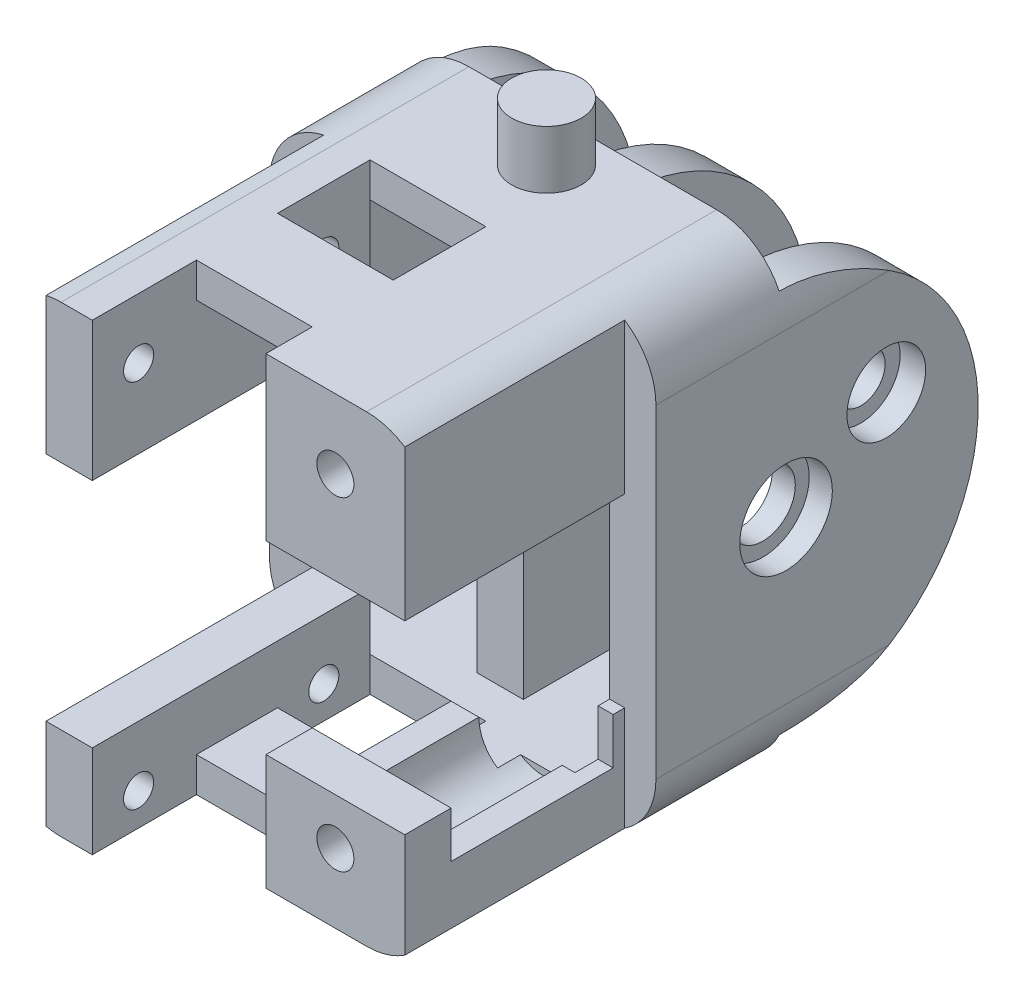
from build123d import *

# Parameters (mm, degrees)
BOSS_EXTRUDE1_DEPTH      = 18
BOSS_EXTRUDE1_DEPTH_BACK = 12
SKETCH9_R                = 1.5
BOSS_EXTRUDE4_DEPTH      = 2.5
BOSS_EXTRUDE5_START      = 2.5
SKETCH10_R               = 1.5
BOSS_EXTRUDE5_DEPTH      = 2.5
EXTRUDE7_DEPTH           = 24.45149249
EXTRUDE7_DEPTH_BACK      = 24.45149249
SKETCH21_R               = 1.4
EXTRUDE8_DEPTH           = 24.45149249
EXTRUDE8_DEPTH_BACK      = 24.45149249
EXTRUDE9_START           = 7.35
SKETCH25_R               = 2
EXTRUDE9_DEPTH           = 10
EXTRUDE10_DEPTH          = 10
EXTRUDE12_START          = 8.5
SKETCH29_R               = 3.5
EXTRUDE12_DEPTH          = 1.5
EXTRUDE13_DEPTH          = 24.451492602
EXTRUDE13_DEPTH_BACK     = 24.451492602
EXTRUDE14_DEPTH          = 1
EXTRUDE14_DEPTH_BACK     = 1
EXTRUDE15_DEPTH          = 10
EXTRUDE15_DEPTH_BACK     = 2
SKETCH_R                 = 1.05
EXTRUDE17_START          = 7.25
SKETCH32_R               = 1.7
EXTRUDE17_DEPTH          = 17.201492602
EXTRUDE22_DEPTH          = 24.451492602
EXTRUDE22_DEPTH_BACK     = 24.451492602
SKETCH37_R               = 1.35
EXTRUDE33_DEPTH          = 1.5
EXTRUDE36_DEPTH          = 24.451492602
EXTRUDE37_START          = -8
SKETCH60_R               = 0.8
EXTRUDE37_DEPTH          = 8
EXTRUDE38_DEPTH          = 28.829281456
EXTRUDE38_DEPTH_BACK     = 9.5
SKETCH61_W               = 14.107676107
SKETCH61_H               = 29.354497892
EXTRUDE39_START          = -9
SKETCH62_R               = 0.8
EXTRUDE39_DEPTH          = 7
EXTRUDE40_START          = -2
EXTRUDE40_DEPTH          = 7
CUT_EXTRUDE_2_DEPTH      = 24.451492602
CUT_EXTRUDE_2_DEPTH_BACK = 24.451492602
SKETCH_5_W               = 8.419130127
SKETCH_5_H               = 23.899200378
SKETCH_3_W               = 12
SKETCH_3_H               = 18
EXTRUDE_2_DEPTH          = 2
SKETCH_4_W               = 12
SKETCH_4_H               = 10
CUT_EXTRUDE_1_DEPTH      = 2
SKETCH_6_R               = 0.65
CUT_EXTRUDE_3_DEPTH      = 2
CUT_EXTRUDE_4_DEPTH      = 28.829281456
CUT_EXTRUDE_4_DEPTH_BACK = 2
SKETCH61_3_W             = 5
SKETCH61_3_H             = 29.354497892
CUT_EXTRUDE_START        = -5.5
SKETCH61_4_W             = 5
SKETCH61_4_H             = 29.354497892
CUT_EXTRUDE_5_DEPTH      = 4


with BuildPart() as part:
    # Sketch1 → Boss-Extrude1 (new, two sides: drawn at the far end of the back side and taken through both)
    with BuildSketch(Plane.XY.offset(-BOSS_EXTRUDE1_DEPTH_BACK)):
        with BuildLine():
            Line((8.35, -7), (8.35, 7))
            ThreePointArc((8.35, 7), (7.471320344, 9.121320344), (5.35, 10))
            Line((5.35, 10), (-5.35, 10))
            ThreePointArc((-5.35, 10), (-7.471320344, 9.121320344), (-8.35, 7))
            Line((-8.35, 7), (-8.35, -7))
            ThreePointArc((-8.35, -7), (-7.471320344, -9.121320344), (-5.35, -10))
            Line((-5.35, -10), (5.35, -10))
            ThreePointArc((5.35, -10), (7.471320344, -9.121320344), (8.35, -7))
        make_face()
        with BuildLine():
            Line((-5.95, -8.5), (5.95, -8.5))
            ThreePointArc((5.95, -8.5), (6.232842712, -8.382842712), (6.35, -8.1))
            Line((6.35, -8.1), (6.35, 8.1))
            ThreePointArc((6.35, 8.1), (6.232842712, 8.382842712), (5.95, 8.5))
            Line((5.95, 8.5), (-5.95, 8.5))
            ThreePointArc((-5.95, 8.5), (-6.232842712, 8.382842712), (-6.35, 8.1))
            Line((-6.35, 8.1), (-6.35, -8.1))
            ThreePointArc((-6.35, -8.1), (-6.232842712, -8.382842712), (-5.95, -8.5))
        make_face(mode=Mode.SUBTRACT)
    extrude(amount=BOSS_EXTRUDE1_DEPTH + BOSS_EXTRUDE1_DEPTH_BACK)

    # Sketch9 → Boss-Extrude4 (add)
    with BuildSketch(Plane(origin=(0, 10, 0), x_dir=(1, 0, 0), z_dir=(0, 1, 0))):
        Circle(SKETCH9_R)
    extrude(amount=BOSS_EXTRUDE4_DEPTH)

    # Sketch10 → Boss-Extrude5 (add)
    with BuildSketch(Plane.XZ.offset(10).offset(BOSS_EXTRUDE5_START)):
        Circle(SKETCH10_R)
    extrude(amount=-BOSS_EXTRUDE5_DEPTH)

    # Sketch21 → Extrude7 (cut, two sides: drawn at the far end of the back side and taken through both)
    with BuildSketch(Plane(origin=(0, 0, 0), x_dir=(0, 0, -1), z_dir=(1, 0, 0)).offset(-EXTRUDE7_DEPTH_BACK)):
        with Locations((2, 0)):
            Circle(SKETCH21_R)
    extrude(amount=EXTRUDE7_DEPTH + EXTRUDE7_DEPTH_BACK, mode=Mode.SUBTRACT)

    # Sketch23 → Extrude8 (cut, two sides: drawn at the far end of the back side and taken through both)
    with BuildSketch(Plane(origin=(0, 0, 0), x_dir=(0, 0, -1), z_dir=(1, 0, 0)).offset(-EXTRUDE8_DEPTH_BACK)):
        with BuildLine():
            Line((2, 10), (2, 9.5))
            Line((2, 9.5), (2, 8.3))
            ThreePointArc((2, 8.3), (7.868986284, 5.868986284), (10.3, 0))
            ThreePointArc((10.3, 0), (7.868986284, -5.868986284), (2, -8.3))
            Line((2, -8.3), (2, -10.617918291))
            Line((2, -10.617918291), (2, -11.441587559))
            Line((2, -11.441587559), (19.192940308, -11.441587559))
            Line((19.192940308, -11.441587559), (19.192940308, 11.538339971))
            Line((19.192940308, 11.538339971), (2, 11.538339971))
            Line((2, 11.538339971), (2, 10))
        make_face()
    extrude(amount=EXTRUDE8_DEPTH + EXTRUDE8_DEPTH_BACK, mode=Mode.SUBTRACT)

    # Sketch25 → Extrude9 (cut)
    with BuildSketch(Plane(origin=(0, 0, 0), x_dir=(0, 0, -1), z_dir=(1, 0, 0)).offset(EXTRUDE9_START)):
        with Locations((2, 0)):
            Circle(SKETCH25_R)
    extrude9 = extrude(amount=EXTRUDE9_DEPTH, mode=Mode.SUBTRACT)

    # Mirror1: Extrude9 across plane
    add(extrude9.mirror(Plane(origin=(0, 0, 0), x_dir=(0, 0, 1), z_dir=(1, 0, 0))), mode=Mode.SUBTRACT)

    # Sketch26 → Extrude10 (cut)
    with BuildSketch(Plane.ZY.offset(7.35)):
        Polygon((-2, 2.367136104), (-4.05, 1.183568052), (-4.05, -1.183568052), (-2, -2.367136104), (0.05, -1.183568052), (0.05, 1.183568052), align=None)
    extrude(amount=EXTRUDE10_DEPTH, mode=Mode.SUBTRACT)

    # Sketch29 → Extrude12 (add)
    with BuildSketch(Plane(origin=(0, 0, 0), x_dir=(1, 0, 0), z_dir=(0, 1, 0)).offset(EXTRUDE12_START)):
        Circle(SKETCH29_R)
    extrude12 = extrude(amount=EXTRUDE12_DEPTH)

    # Mirror2: Extrude12 across plane
    add(extrude12.mirror(Plane.ZX))

    # Sketch27 → Extrude13 (cut, two sides: drawn at the far end of the back side and taken through both)
    with BuildSketch(Plane(origin=(0, 0, 0), x_dir=(1, 0, 0), z_dir=(0, 1, 0)).offset(-EXTRUDE13_DEPTH_BACK)):
        with BuildLine():
            Line((6.35, 10.3), (-6.35, 10.3))
            Line((-6.35, 10.3), (-6.35, 2.8))
            ThreePointArc((-6.35, 2.8), (-6.115685425, 2.234314575), (-5.55, 2))
            Line((-5.55, 2), (5.55, 2))
            ThreePointArc((5.55, 2), (6.115685425, 2.234314575), (6.35, 2.8))
            Line((6.35, 2.8), (6.35, 10.3))
        make_face()
    extrude(amount=EXTRUDE13_DEPTH + EXTRUDE13_DEPTH_BACK, mode=Mode.SUBTRACT)

    # Sketch30 → Extrude14 (add, two sides: drawn at the far end of the back side and taken through both)
    with BuildSketch(Plane(origin=(0, 0, 0), x_dir=(0, 0, -1), z_dir=(1, 0, 0)).offset(-EXTRUDE14_DEPTH_BACK)):
        with BuildLine():
            Line((2, 10), (0, 10))
            Line((0, 10), (-1.5, 10))
            Line((-1.5, 10), (-2, 10))
            Line((-2, 10), (-2, 0))
            Line((-2, 0), (-2, -10))
            Line((-2, -10), (-1.5, -10))
            Line((-1.5, -10), (0, -10))
            Line((0, -10), (2, -10))
            Line((2, -10), (2, -8.3))
            ThreePointArc((2, -8.3), (10.3, 0), (2, 8.3))
            Line((2, 8.3), (2, 10))
        make_face()
    extrude(amount=EXTRUDE14_DEPTH + EXTRUDE14_DEPTH_BACK)

    # Sketch → Extrude15 (cut, two sides: drawn at the far end of the back side and taken through both)
    with BuildSketch(Plane(origin=(0, 0, 0), x_dir=(0, 0, -1), z_dir=(1, 0, 0)).offset(-EXTRUDE15_DEPTH_BACK)):
        with Locations((6.330127019, 2.5)):
            Circle(SKETCH_R)
    extrude(amount=EXTRUDE15_DEPTH + EXTRUDE15_DEPTH_BACK, mode=Mode.SUBTRACT)

    # Sketch32 → Extrude17 (cut, through all)
    with BuildSketch(Plane(origin=(0, 0, 0), x_dir=(0, 0, -1), z_dir=(1, 0, 0)).offset(EXTRUDE17_START)):
        with Locations((6.330127019, 2.5)):
            Circle(SKETCH32_R)
    extrude(amount=EXTRUDE17_DEPTH, mode=Mode.SUBTRACT)

    # Sketch37 → Extrude22 (cut, two sides: drawn at the far end of the back side and taken through both)
    with BuildSketch(Plane(origin=(0, 0, 0), x_dir=(0, 0, -1), z_dir=(1, 0, 0)).offset(-EXTRUDE22_DEPTH_BACK)):
        with Locations((2, 0)):
            Circle(SKETCH37_R)
    extrude(amount=EXTRUDE22_DEPTH + EXTRUDE22_DEPTH_BACK, mode=Mode.SUBTRACT)

    # Sketch54 → Extrude33 (cut)
    with BuildSketch(Plane.ZY.offset(1)):
        Polygon((-5.560381872, 4.305775662), (-7.509102043, 4.069506683), (-8.278847189, 2.26373102), (-7.099872166, 0.694224338), (-5.151151995, 0.930493317), (-4.381406849, 2.73626898), align=None)
    extrude(amount=-EXTRUDE33_DEPTH, mode=Mode.SUBTRACT)

    # Sketch58 → Extrude36 (cut, through all)
    with BuildSketch(Plane(origin=(0, 0, 0), x_dir=(0, 0, -1), z_dir=(1, 0, 0))):
        Polygon((-13.12, -6.903007014), (-13.12, 0.096992986), (-13.12, 7.096992986), (-13.12, 13.118822845), (-23.547049922, 13.118822845), (-23.547049922, -15.83915854), (-13.12, -15.83915854), align=None)
    extrude(amount=EXTRUDE36_DEPTH, mode=Mode.SUBTRACT)

    # Sketch60 → Extrude37 (add)
    # profile 1 of 2: a face of its own
    with BuildSketch(Plane.XY.offset(13.12).offset(EXTRUDE37_START)):
        with BuildLine():
            Line((1, 3), (4, 3))
            Line((4, 3), (6.35, 3))
            Line((6.35, 3), (6.35, 8.1))
            ThreePointArc((6.35, 8.1), (6.232842712, 8.382842712), (5.95, 8.5))
            Line((5.95, 8.5), (1, 8.5))
            Line((1, 8.5), (1, 3))
        make_face()
        with Locations((4, 7)):
            Circle(SKETCH60_R, mode=Mode.SUBTRACT)
    # profile 2 of 2: a face of its own
    with BuildSketch(Plane.XY.offset(13.12).offset(EXTRUDE37_START)):
        with BuildLine():
            Line((6.35, -5), (4, -5))
            Line((4, -5), (1, -5))
            Line((1, -5), (1, -8.5))
            Line((1, -8.5), (5.95, -8.5))
            ThreePointArc((5.95, -8.5), (6.232842712, -8.382842712), (6.35, -8.1))
            Line((6.35, -8.1), (6.35, -5))
        make_face()
        with Locations((4, -7)):
            Circle(SKETCH60_R, mode=Mode.SUBTRACT)
    extrude(amount=EXTRUDE37_DEPTH)

    # Sketch61 → Extrude38 (cut, two sides: drawn at the far end of the back side and taken through both)
    with BuildSketch(Plane.XY.offset(13.12).offset(-EXTRUDE38_DEPTH_BACK)):
        Polygon((7, 12.951790406), (7, 3), (1, 3), (1, -5), (7, -5), (7, -12.64180087), (12.797800394, -12.64180087), (12.797800394, 12.951790406), align=None)
        with Locations((-13.053838053, 0.518529956)):
            Rectangle(SKETCH61_W, SKETCH61_H)
    extrude(amount=EXTRUDE38_DEPTH + EXTRUDE38_DEPTH_BACK, mode=Mode.SUBTRACT)

    # Sketch62 → Extrude39 (cut)
    with BuildSketch(Plane.XY.offset(13.12).offset(EXTRUDE39_START)):
        with BuildLine():
            ThreePointArc((5.8, 7), (4, 8.8), (2.2, 7))
            Line((2.2, 7), (2.2, 1.61060248))
            Line((2.2, 1.61060248), (5.8, 1.61060248))
            Line((5.8, 1.61060248), (5.8, 7))
        make_face()
        with Locations((4, 7)):
            Circle(SKETCH62_R, mode=Mode.SUBTRACT)
    extrude(amount=EXTRUDE39_DEPTH, mode=Mode.SUBTRACT)

    # Sketch 2 → Extrude40 (cut)
    with BuildSketch(Plane.XY.offset(13.12).offset(EXTRUDE40_START)):
        with BuildLine():
            Line((-2.9189954, -7), (2.2, -7))
            ThreePointArc((2.2, -7), (4, -8.8), (5.8, -7))
            Line((5.8, -7), (10.709143859, -7))
            Line((10.709143859, -7), (10.709143859, -3.375620106))
            Line((10.709143859, -3.375620106), (-2.9189954, -3.375620106))
            Line((-2.9189954, -3.375620106), (-2.9189954, -7))
        make_face()
    extrude(amount=-EXTRUDE40_DEPTH, mode=Mode.SUBTRACT)

    # Эскиз5 → Вырез-Вытянуть2 (cut, two sides: drawn at the far end of the back side and taken through both)
    with BuildSketch(Plane(origin=(0, 0, 0), x_dir=(0, 0, -1), z_dir=(1, 0, 0)).offset(-CUT_EXTRUDE_2_DEPTH_BACK)):
        with Locations((-19.829565063, 0.504683387)):
            Rectangle(SKETCH_5_W, SKETCH_5_H)
    extrude(amount=CUT_EXTRUDE_2_DEPTH + CUT_EXTRUDE_2_DEPTH_BACK, mode=Mode.SUBTRACT)

    # Эскиз3 → Бобышка-Вытянуть2 (add)
    with BuildSketch(Plane.ZY.offset(6)):
        with Locations((9.62, 0)):
            Rectangle(SKETCH_3_W, SKETCH_3_H)
    extrude(amount=-EXTRUDE_2_DEPTH)

    # Эскиз4 → Вырез-Вытянуть1 (cut)
    with BuildSketch(Plane.ZY.offset(6)):
        with Locations((9.62, -1)):
            Rectangle(SKETCH_4_W, SKETCH_4_H)
    extrude(amount=-CUT_EXTRUDE_1_DEPTH, mode=Mode.SUBTRACT)

    # Эскиз6 → Вырез-Вытянуть3 (cut)
    with BuildSketch(Plane.ZY.offset(6)):
        with Locations((5.62, -8.6)):
            Circle(SKETCH_6_R)
        with Locations((5.62, 7.4)):
            Circle(SKETCH_6_R)
        with Locations((13.62, 7.4)):
            Circle(SKETCH_6_R)
        with Locations((13.62, -8.6)):
            Circle(SKETCH_6_R)
    extrude(amount=-CUT_EXTRUDE_3_DEPTH, mode=Mode.SUBTRACT)

    # Sketch61<3> → Вырез-Вытянуть4 (cut, two sides: drawn at the far end of the back side and taken through both)
    with BuildSketch(Plane.XY.offset(13.12).offset(-CUT_EXTRUDE_4_DEPTH_BACK)):
        with Locations((-1.5, 0.518529956)):
            Rectangle(SKETCH61_3_W, SKETCH61_3_H)
    extrude(amount=CUT_EXTRUDE_4_DEPTH + CUT_EXTRUDE_4_DEPTH_BACK, mode=Mode.SUBTRACT)

    # Sketch61<4> → Вырез-Вытянуть5 (cut)
    with BuildSketch(Plane.XY.offset(13.12).offset(CUT_EXTRUDE_START)):
        with Locations((-1.5, 0.518529956)):
            Rectangle(SKETCH61_4_W, SKETCH61_4_H)
    extrude(amount=-CUT_EXTRUDE_5_DEPTH, mode=Mode.SUBTRACT)


solid = part.part
